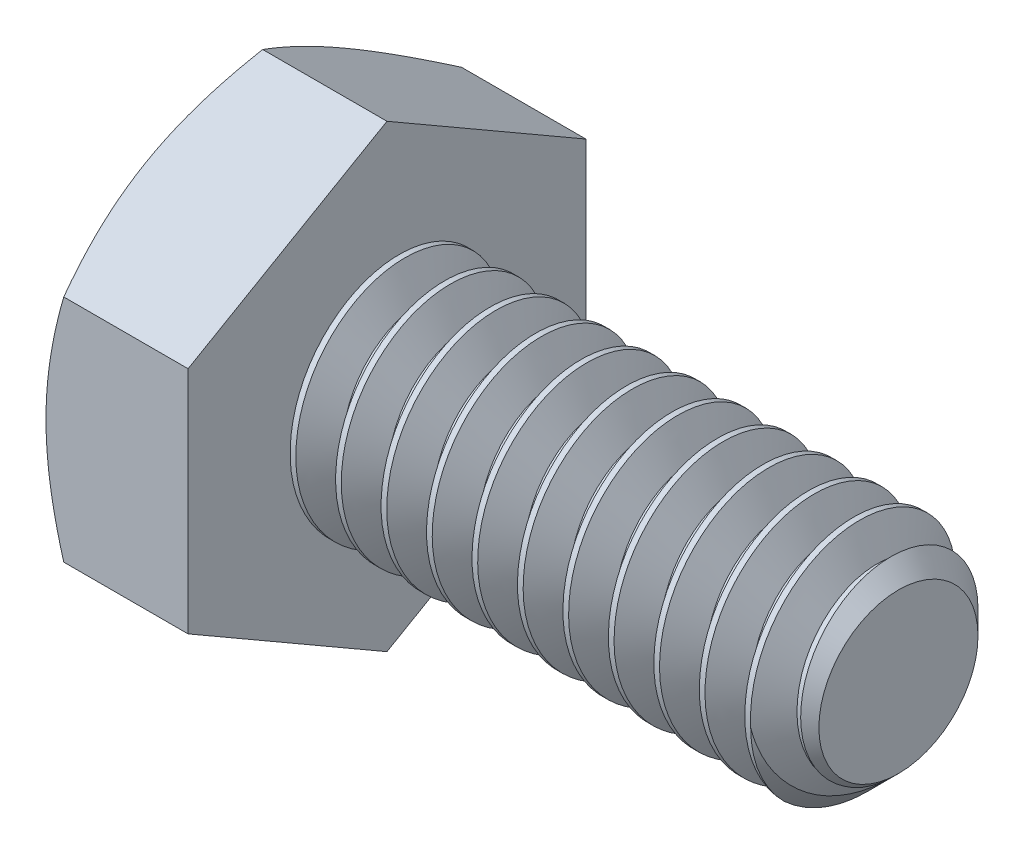
from build123d import *

# Parameters (mm, degrees)
SKETCH5_R           = 3.175
BOSS_EXTRUDE3_DEPTH = 14.2875
CHAMFER1_SIZE       = 0.9525
CUT_SWEEP1_PITCH    = 1.27
BOSS_EXTRUDE4_DEPTH = 3.96875
SKETCH8_OUTSIDE_W   = 91.304
SKETCH8_OUTSIDE_H   = 93.024
SKETCH8_OUTSIDE_R   = 5.55625
CUT_EXTRUDE3_DEPTH  = 21.132688252
CUT_EXTRUDE3_DRAFT  = -60


with BuildPart() as part:
    # Sketch5 → Boss-Extrude3 (new body)
    with BuildSketch(Plane(origin=(9.128125, 0, 0), x_dir=(0, 0, -1), z_dir=(1, 0, 0))):
        Circle(SKETCH5_R)
    extrude(amount=-BOSS_EXTRUDE3_DEPTH)

    # Chamfer1
    chamfer1_edges = [part.edges().sort_by_distance(p)[0] for p in [
        (9.128125, 0, 3.175),
    ]]
    chamfer(chamfer1_edges, length=CHAMFER1_SIZE)

    # Cut-Sweep1: the profile of Sketch10 profile screwed along a right-hand helix of 12.25 turns, 8 arcs to a turn; built about Z, then put on its axis
    cut_sweep1_z = Axis((0, 0, 0), (0, 0, 1))
    cut_sweep1_corners = [(3.1753, 0, 0.000173205), (2.350110803, 0, -0.47625), (2.350110803, 0, -0.635), (3.1753, 0, -1.111423205)]
    with BuildLine(mode=Mode.PRIVATE) as cut_sweep1_profile:
        Line(cut_sweep1_corners[0], cut_sweep1_corners[1])
        Line(cut_sweep1_corners[1], cut_sweep1_corners[2])
        Line(cut_sweep1_corners[2], cut_sweep1_corners[3])
        Line(cut_sweep1_corners[3], cut_sweep1_corners[0])
    cut_sweep1_cap = Face(cut_sweep1_profile.wire())
    cut_sweep1_turn_angles = [0, 22.5, 45, 67.5, 90, 112.5, 135, 157.5, 180, 202.5, 225, 247.5, 270, 292.5, 315, 337.5, 360]
    cut_sweep1_turn_weights = [1, 0.9238795325112867, 1, 0.9238795325112867, 1, 0.9238795325112867, 1, 0.9238795325112867, 1, 0.9238795325112867, 1, 0.9238795325112867, 1, 0.9238795325112867, 1, 0.9238795325112867, 1]
    cut_sweep1_turn_rails = [Edge.make_bspline([Vector(p[0], p[1], 0).rotate(cut_sweep1_z, cut_sweep1_turn_angles[k]) / cut_sweep1_turn_weights[k] + Vector(0, 0, p[2] + CUT_SWEEP1_PITCH * cut_sweep1_turn_angles[k] / 360) for k in range(17)], [0, 0, 0, 1, 1, 2, 2, 3, 3, 4, 4, 5, 5, 6, 6, 7, 7, 8, 8, 8], 2, cut_sweep1_turn_weights) for p in cut_sweep1_corners]
    cut_sweep1_turn_sides = [Face.make_surface_from_curves(cut_sweep1_turn_rails[p[0]], cut_sweep1_turn_rails[p[1]]) for p in [(0, 1), (1, 2), (2, 3), (3, 0)]]
    cut_sweep1_last_angles = [4320, 4342.5, 4365, 4387.5, 4410]
    cut_sweep1_last_weights = [1, 0.9238795325112867, 1, 0.9238795325111926, 1]
    cut_sweep1_last_rails = [Edge.make_bspline([Vector(p[0], p[1], 0).rotate(cut_sweep1_z, cut_sweep1_last_angles[k]) / cut_sweep1_last_weights[k] + Vector(0, 0, p[2] + CUT_SWEEP1_PITCH * cut_sweep1_last_angles[k] / 360) for k in range(5)], [0, 0, 0, 1, 1, 2, 2, 2], 2, cut_sweep1_last_weights) for p in cut_sweep1_corners]
    cut_sweep1_last_sides = [Face.make_surface_from_curves(cut_sweep1_last_rails[p[0]], cut_sweep1_last_rails[p[1]]) for p in [(0, 1), (1, 2), (2, 3), (3, 0)]]
    cut_sweep1 = Plane(origin=(9.128125, 0, 0), x_dir=(0, 1, 0), z_dir=(-1, 0, 0)) * Solid(Shell([*[p.moved(Location((0, 0, CUT_SWEEP1_PITCH * i))) for i in range(12) for p in cut_sweep1_turn_sides], *cut_sweep1_last_sides, cut_sweep1_cap, cut_sweep1_cap.rotate(cut_sweep1_z, 4410).moved(Location((0, 0, CUT_SWEEP1_PITCH * 4410 / 360)))]))
    add(cut_sweep1, mode=Mode.SUBTRACT)

    # Sketch6 → Boss-Extrude4 (add)
    with BuildSketch(Plane.ZY.offset(5.159375)):
        Polygon((5.55625, 3.207902433), (0, 6.415804866), (-5.55625, 3.207902433), (-5.55625, -3.207902433), (0, -6.415804866), (5.55625, -3.207902433), align=None)
    extrude(amount=BOSS_EXTRUDE4_DEPTH)


with BuildPart() as cut_extrude3_tool:
    # Sketch8 outside → Cut-Extrude3 (with draft: the straight prism first)
    with BuildSketch(Plane.ZY.offset(9.128125)):
        Rectangle(SKETCH8_OUTSIDE_W, SKETCH8_OUTSIDE_H)
        Circle(SKETCH8_OUTSIDE_R, mode=Mode.SUBTRACT)
    extrude(amount=-CUT_EXTRUDE3_DEPTH)
    # Cut-Extrude3: the draft: its side faces are tilted about the plane it starts from
    cut_extrude3_sides = [cut_extrude3_tool.faces().sort_by_distance(p)[0] for p in [
        (1.438219126, -46.512, 0),
        (1.438219126, 0, 45.652),
        (1.438219126, 46.512, 0),
        (1.438219126, 0, -45.652),
        (1.438219126, 0, -5.55625),
    ]]
    draft(cut_extrude3_sides, Plane.ZY.offset(9.128125), CUT_EXTRUDE3_DRAFT)


with BuildPart() as part_1:
    add(part.part)

    # Cut-Extrude3: cut by cut_extrude3_tool
    add(cut_extrude3_tool.part, mode=Mode.SUBTRACT)


solid = part_1.part
